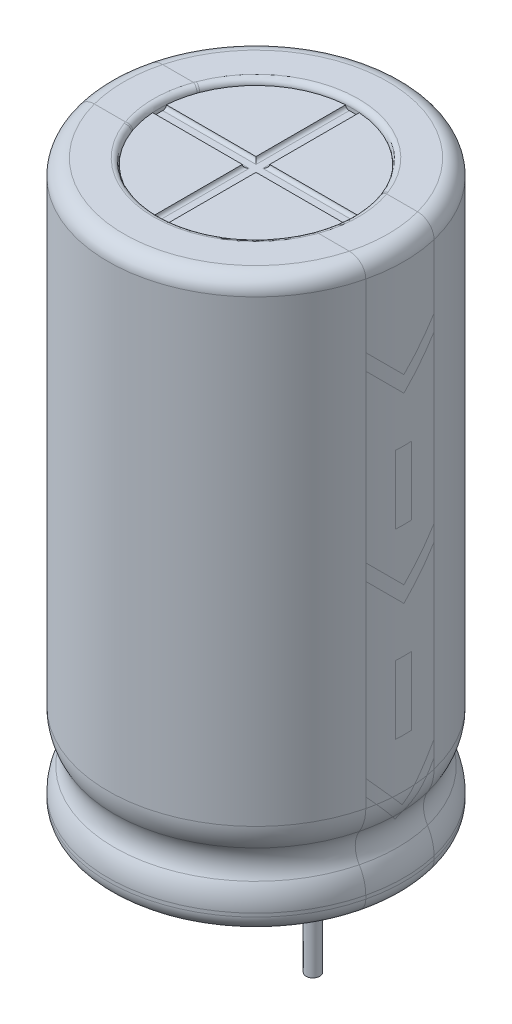
from build123d import *

# Parameters (mm, degrees)
SKETCH_2_R          = 4.25
CUT_EXTRUDE_1_DEPTH = 0.25
CUT_EXTRUDE_2_DEPTH = 0.15
FILLET_1_R          = 0.7
FILLET_2_R          = 2
CUT_EXTRUDE_START   = -0.25
SKETCH_4_R          = 4.25
CUT_EXTRUDE_3_DEPTH = 0.25
SKETCH_5_R          = 0.3
EXTRUDE_1_DEPTH     = 5
FILLET_3_R          = 0.15
FILLET_4_R          = 0.25
FILLET_5_R          = 0.25


with BuildPart() as part:
    # Эскиз1 → Повернуть2 (revolve)
    with BuildSketch(Plane.XY, mode=Mode.PRIVATE) as revolve_2_sk:
        with BuildLine():
            Line((0, 0), (-6.5, 0))
            Line((-6.5, 0), (-6.5, 1.539531364))
            ThreePointArc((-6.5, 1.539531364), (-6.05, 2.5), (-6.5, 3.460468636))
            Line((-6.5, 3.460468636), (-6.5, 25))
            Line((-6.5, 25), (0, 25))
            Line((0, 25), (0, 0))
        make_face()
    revolve(revolve_2_sk.sketch.rotate(Axis((0, 47.03836845, 0), (0, -1, 0)), 270), axis=Axis((0, 47.03836845, 0), (0, -1, 0)))

    # Эскиз2 → Вырез-Вытянуть1 (cut)
    with BuildSketch(Plane(origin=(0, 25, 0), x_dir=(1, 0, 0), z_dir=(0, 1, 0))):
        with Locations(Location((0, 0, 0), (0, 0, 270))):
            Circle(SKETCH_2_R)
    extrude(amount=-CUT_EXTRUDE_1_DEPTH, mode=Mode.SUBTRACT)

    # Эскиз3 → Вырез-Вытянуть2 (cut)
    with BuildSketch(Plane(origin=(0, 24.75, 0), x_dir=(1, 0, 0), z_dir=(0, 1, 0))):
        with BuildLine():
            Line((-0.3, 4.239398542), (-0.3, 0.3))
            Line((-0.3, 0.3), (-4.239398542, 0.3))
            ThreePointArc((-4.239398542, 0.3), (-4.25, 0), (-4.239398542, -0.3))
            Line((-4.239398542, -0.3), (-0.3, -0.3))
            Line((-0.3, -0.3), (-0.3, -4.239398542))
            ThreePointArc((-0.3, -4.239398542), (0, -4.25), (0.3, -4.239398542))
            Line((0.3, -4.239398542), (0.3, -0.3))
            Line((0.3, -0.3), (4.239398542, -0.3))
            ThreePointArc((4.239398542, -0.3), (4.25, 0), (4.239398542, 0.3))
            Line((4.239398542, 0.3), (0.3, 0.3))
            Line((0.3, 0.3), (0.3, 4.239398542))
            ThreePointArc((0.3, 4.239398542), (0, 4.25), (-0.3, 4.239398542))
        make_face()
    extrude(amount=-CUT_EXTRUDE_2_DEPTH, mode=Mode.SUBTRACT)

    # Скругление1
    fillet_1_edges = [part.edges().sort_by_distance(p)[0] for p in [
        (0, 0, -6.5),
        (0, 25, -6.5),
    ]]
    fillet(fillet_1_edges, radius=FILLET_1_R)

    # Скругление2
    fillet_2_edges = [part.edges().sort_by_distance(p)[0] for p in [
        (0, 1.539531364, -6.5),
        (0, 3.460468636, -6.5),
    ]]
    fillet(fillet_2_edges, radius=FILLET_2_R)

    # Эскиз4 → Вырез-Вытянуть3 (cut)
    with BuildSketch(Plane.XZ.offset(CUT_EXTRUDE_START)):
        with Locations(Location((0, 0, 0), (0, 0, 90))):
            Circle(SKETCH_4_R)
    extrude(amount=CUT_EXTRUDE_3_DEPTH, mode=Mode.SUBTRACT)

    # Эскиз5 → Бобышка-Вытянуть1 (add)
    with BuildSketch(Plane.XZ.offset(-0.25)):
        with Locations(Location((-2.5, 0, 0), (0, 0, 270))):
            Circle(SKETCH_5_R)
        with Locations(Location((2.5, 0, 0), (0, 0, 90))):
            Circle(SKETCH_5_R)
    extrude(amount=EXTRUDE_1_DEPTH)

    # Скругление3
    fillet_3_edges = [part.edges().sort_by_distance(p)[0] for p in [
        (0.3, 24.6, -2.269699271),
        (-2.269699271, 24.6, 0.3),
        (2.269699271, 24.6, 0.3),
        (0.3, 24.6, 2.269699271),
        (-0.3, 24.6, 2.269699271),
        (2.269699271, 24.6, -0.3),
        (-0.3, 24.6, -2.269699271),
        (-2.269699271, 24.6, -0.3),
    ]]
    fillet(fillet_3_edges, radius=FILLET_3_R - 0.0001)  # a hair under: the kernel refuses the full size

    # Скругление4
    fillet_4_edges = [part.edges().sort_by_distance(p)[0] for p in [
        (0, 25, -4.25),
    ]]
    fillet(fillet_4_edges, radius=FILLET_4_R - 0.0001)  # a hair under: the kernel refuses the full size

    # Скругление5
    fillet_5_edges = [part.edges().sort_by_distance(p)[0] for p in [
        (0, 0, -4.25),
    ]]
    fillet(fillet_5_edges, radius=FILLET_5_R - 0.0001)  # a hair under: the kernel refuses the full size


solid = part.part
